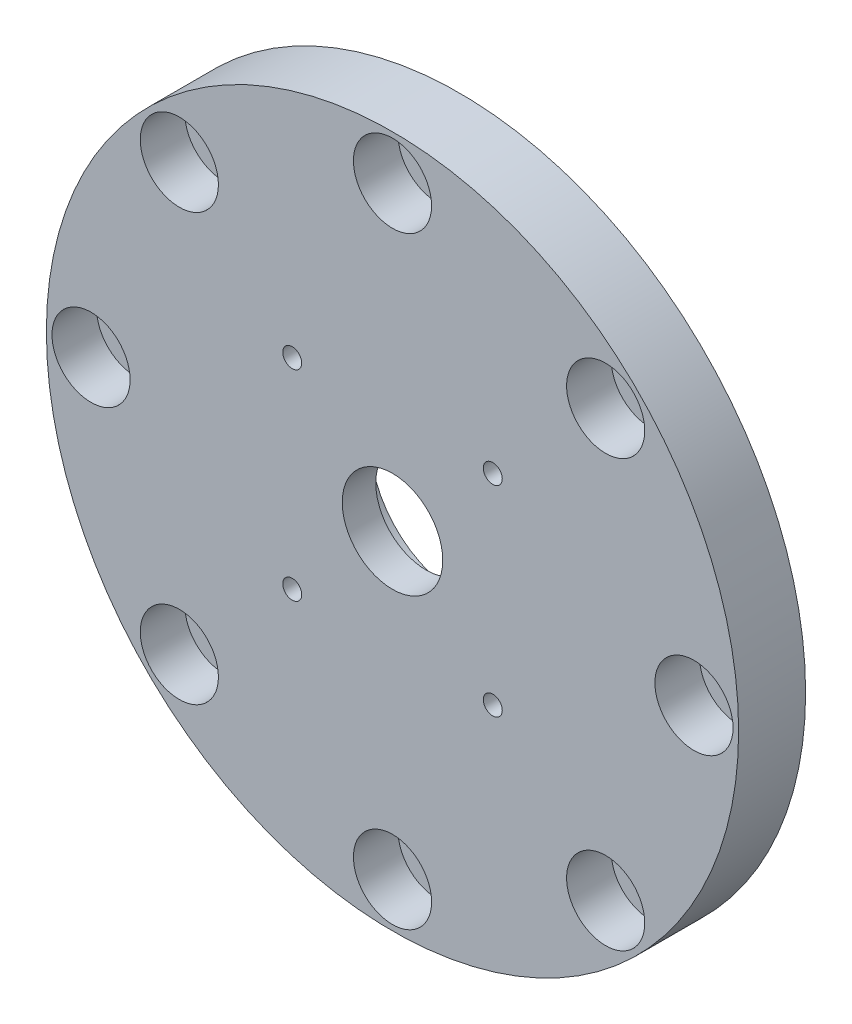
from build123d import *

# Parameters (mm, degrees)
SKETCH1_R           = 31
SKETCH1_R_2         = 4.5
SKETCH1_R_3         = 0.85
SKETCH1_R_4         = 1.55
BOSS_EXTRUDE2_DEPTH = 6
SKETCH5_R           = 8
CUT_EXTRUDE3_DEPTH  = 3
SKETCH6_R           = 3.5
CUT_EXTRUDE4_DEPTH  = 4


with BuildPart() as part:
    # Sketch1 → Boss-Extrude2 (new body)
    with BuildSketch(Plane.XY):
        Circle(SKETCH1_R)
        Circle(SKETCH1_R_2, mode=Mode.SUBTRACT)
        with Locations((8.980256121, 8.980256121)):
            Circle(SKETCH1_R_3, mode=Mode.SUBTRACT)
        with Locations((8.980256121, -8.980256121)):
            Circle(SKETCH1_R_3, mode=Mode.SUBTRACT)
        with Locations((-8.980256121, -8.980256121)):
            Circle(SKETCH1_R_3, mode=Mode.SUBTRACT)
        with Locations((-8.980256121, 8.980256121)):
            Circle(SKETCH1_R_3, mode=Mode.SUBTRACT)
        with Locations((-27, 0)):
            Circle(SKETCH1_R_4, mode=Mode.SUBTRACT)
        with Locations((-19.091883092, 19.091883092)):
            Circle(SKETCH1_R_4, mode=Mode.SUBTRACT)
        with Locations((0, 27)):
            Circle(SKETCH1_R_4, mode=Mode.SUBTRACT)
        with Locations((19.091883092, 19.091883092)):
            Circle(SKETCH1_R_4, mode=Mode.SUBTRACT)
        with Locations((27, 0)):
            Circle(SKETCH1_R_4, mode=Mode.SUBTRACT)
        with Locations((19.091883092, -19.091883092)):
            Circle(SKETCH1_R_4, mode=Mode.SUBTRACT)
        with Locations((0, -27)):
            Circle(SKETCH1_R_4, mode=Mode.SUBTRACT)
        with Locations((-19.091883092, -19.091883092)):
            Circle(SKETCH1_R_4, mode=Mode.SUBTRACT)
    extrude(amount=BOSS_EXTRUDE2_DEPTH)

    # Sketch5 → Cut-Extrude3 (cut)
    with BuildSketch(Plane(origin=(0, 0, 0), x_dir=(-1, 0, 0), z_dir=(0, 0, -1))):
        Circle(SKETCH5_R)
    extrude(amount=-CUT_EXTRUDE3_DEPTH, mode=Mode.SUBTRACT)

    # Sketch6 → Cut-Extrude4 (cut)
    with BuildSketch(Plane.XY.offset(6)):
        with Locations((0, 27)):
            Circle(SKETCH6_R)
        with Locations((19.091883092, 19.091883092)):
            Circle(SKETCH6_R)
        with Locations((27, 0)):
            Circle(SKETCH6_R)
        with Locations((19.091883092, -19.091883092)):
            Circle(SKETCH6_R)
        with Locations((0, -27)):
            Circle(SKETCH6_R)
        with Locations((-19.091883092, -19.091883092)):
            Circle(SKETCH6_R)
        with Locations((-27, 0)):
            Circle(SKETCH6_R)
        with Locations((-19.091883092, 19.091883092)):
            Circle(SKETCH6_R)
    extrude(amount=-CUT_EXTRUDE4_DEPTH, mode=Mode.SUBTRACT)


solid = part.part
